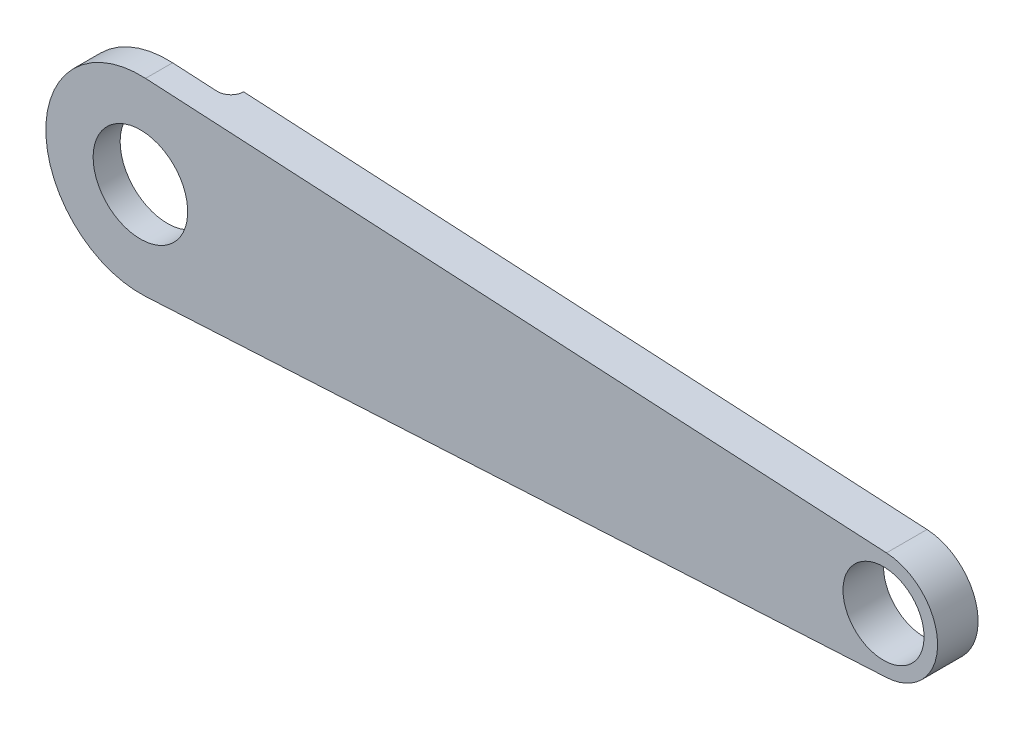
from build123d import *

# Parameters (mm, degrees)
SKETCH1_R               = 88.9
SKETCH1_R_2             = 76.2
BOSS_EXTRUDE1_DEPTH     = 38.1
CUT_EXTRUDE1_DEPTH      = 940.915106169
CUT_EXTRUDE1_DEPTH_BACK = 940.915106169
SKETCH2_W               = 304.8
SKETCH2_H               = 25.4
FILLET1_R               = 25.4


with BuildPart() as part:
    # Sketch1 → Boss-Extrude1 (new, symmetric)
    with BuildSketch(Plane.XY):
        with BuildLine():
            Line((-688.801818182, 177.535307107), (704.041818182, 101.448746918))
            ThreePointArc((704.041818182, 101.448746918), (800.1, 0), (704.041818182, -101.448746918))
            Line((704.041818182, -101.448746918), (-688.801818182, -177.535307107))
            ThreePointArc((-688.801818182, -177.535307107), (-876.3, 0), (-688.801818182, 177.535307107))
        make_face()
        with Locations(Location((-698.5, 0, 0), (0, 0, 180))):
            Circle(SKETCH1_R, mode=Mode.SUBTRACT)
        with Locations(Location((698.5, 0, 0), (0, 0, 180))):
            Circle(SKETCH1_R_2, mode=Mode.SUBTRACT)
    extrude(amount=BOSS_EXTRUDE1_DEPTH, both=True)

    # Sketch2 → Cut-Extrude1 (cut, two sides: drawn at the far end of the back side and taken through both)
    with BuildSketch(Plane(origin=(7.62, -139.492027012, 0), x_dir=(0.998511288563344, 0.054545454545454695, 0), z_dir=(0.054545454545454695, -0.998511288563344, 0)).offset(-CUT_EXTRUDE1_DEPTH_BACK)):
        with Locations((-722.860135061, -25.4)):
            Rectangle(SKETCH2_W, SKETCH2_H)
    extrude(amount=CUT_EXTRUDE1_DEPTH + CUT_EXTRUDE1_DEPTH_BACK, mode=Mode.SUBTRACT)

    # Fillet1
    fillet1_edges = [part.edges().sort_by_distance(p)[0] for p in [
        (-571.338545978, 0.510632627, -12.7),
    ]]
    fillet(fillet1_edges, radius=FILLET1_R - 0.0001)  # a hair under: the kernel refuses the full size


solid = part.part
